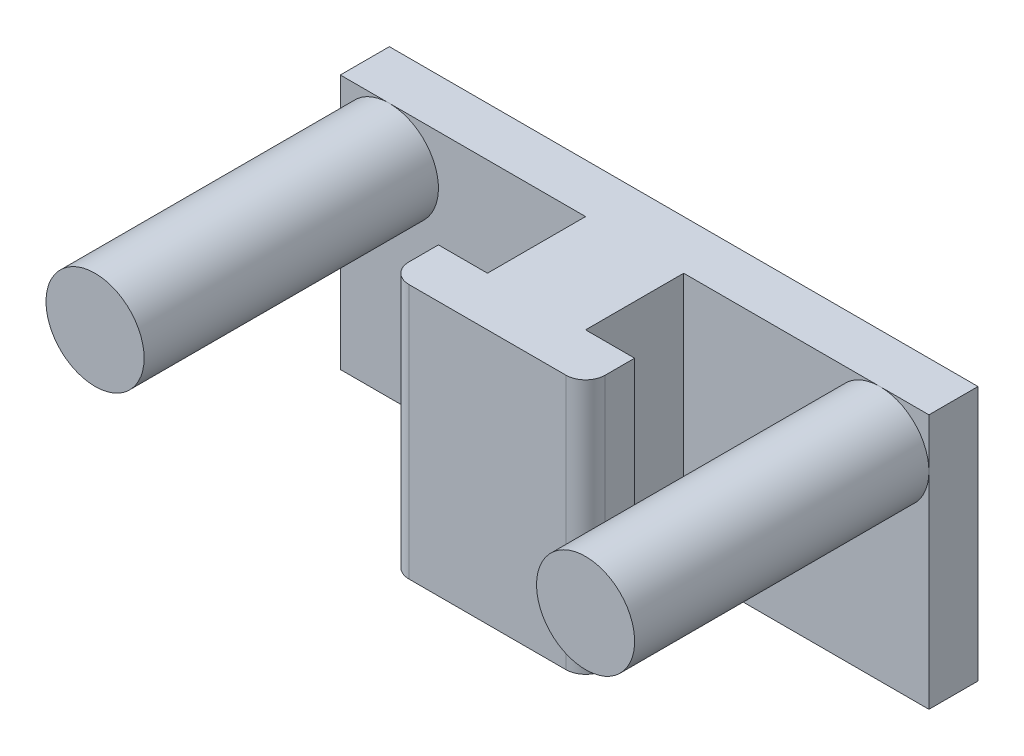
from build123d import *

# Parameters (mm, degrees)
BOSS_EXTRUDE1_DEPTH = 26
SKETCH2_R           = 5
BOSS_EXTRUDE2_DEPTH = 30
FILLET1_R           = 2


with BuildPart() as part:
    # Sketch1 → Boss-Extrude1 (new body)
    with BuildSketch(Plane(origin=(0, 0, 0), x_dir=(1, 0, 0), z_dir=(0, 1, 0))):
        Polygon((10, 0), (10, 5), (5, 5), (5, 15), (30, 15), (30, 20), (-30, 20), (-30, 15), (-5, 15), (-5, 5), (-10, 5), (-10, 0), align=None)
    extrude(amount=BOSS_EXTRUDE1_DEPTH)

    # Sketch2 → Boss-Extrude2 (add)
    with BuildSketch(Plane.XY.offset(-15)):
        with Locations((-25, 21)):
            Circle(SKETCH2_R)
    boss_extrude2 = extrude(amount=BOSS_EXTRUDE2_DEPTH)

    # Mirror1: Boss-Extrude2 across plane
    add(boss_extrude2.mirror(Plane(origin=(0, 0, 0), x_dir=(0, 0, 1), z_dir=(1, 0, 0))))

    # Fillet1
    fillet1_edges = [part.edges().sort_by_distance(p)[0] for p in [
        (10, 13, 0),
        (-10, 13, 0),
    ]]
    fillet(fillet1_edges, radius=FILLET1_R)


solid = part.part
